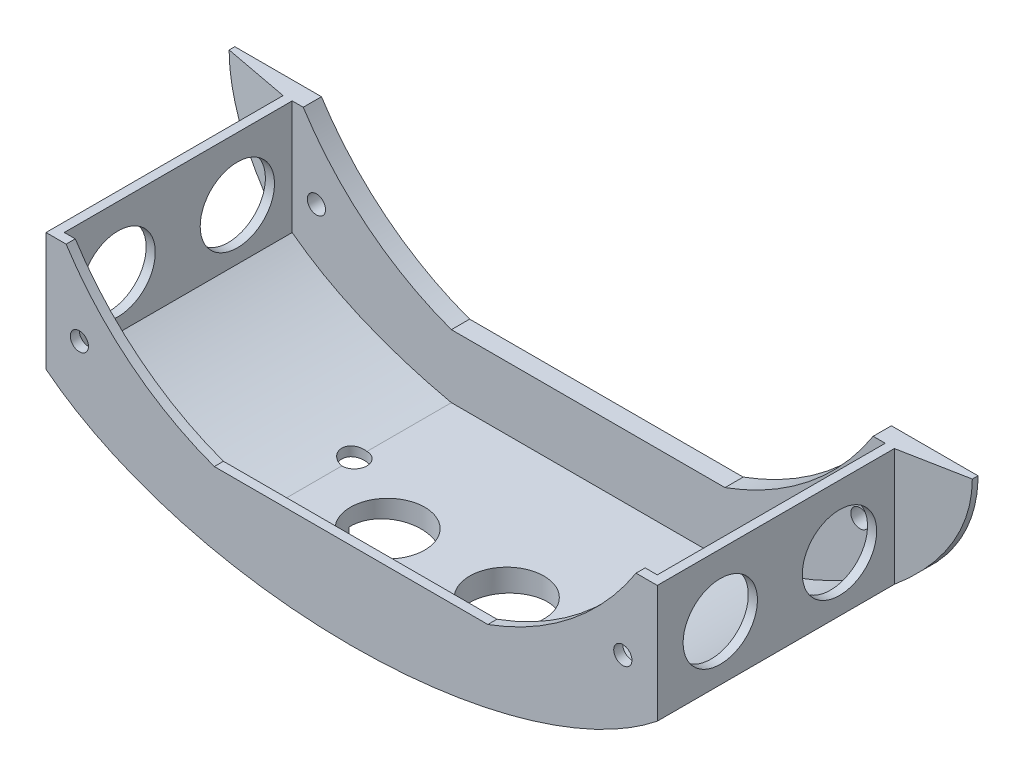
from build123d import *

# Parameters (mm, degrees)
CROQUIS1_R              = 2
SALIENTE_EXTRUIR1_DEPTH = 4
SALIENTE_EXTRUIR4_DEPTH = 50
SALIENTE_EXTRUIR5_DEPTH = 50
SALIENTE_EXTRUIR6_DEPTH = 50
CROQUIS5_R              = 8.15
CROQUIS5_R_2            = 2.75
CORTAR_EXTRUIR1_DEPTH   = 108.625508297
CROQUIS7_R              = 8.15
CORTAR_EXTRUIR2_DEPTH   = 163.92045204
CORTAR_EXTRUIR3_DEPTH   = 45
SALIENTE_EXTRUIR7_REACH = 110.42
CROQUIS9_RX             = 3.839992974
CROQUIS9_RY             = 1.30664239
CROQUIS10_R             = 2
SALIENTE_EXTRUIR8_DEPTH = 2


with BuildPart() as part:
    # Croquis1 → Saliente-Extruir1 (new body)
    with BuildSketch(Plane.XY):
        with BuildLine():
            Line((30, 14), (-30, 14))
            ThreePointArc((-30, 14), (-48.387263047, 24.328421191), (-62.5, 40))
            Line((-62.5, 40), (-81.5, 40))
            add(Edge.make_bspline(
                [(-81.5, 40), (-81.5, 36.750529527), (-80.260995736, 30.280968201), (-73.321740908, 18.442769728), (-57.739765713, 6.428777931), (-31.065541534, -2.851449154), (0, -6.074275423), (31.065541534, -2.851449154), (57.739765713, 6.428777931), (73.321740908, 18.442769728), (80.260995736, 30.280968201), (81.5, 36.750529527), (81.5, 40)],
                knots=[3.141592654, 3.141592654, 3.141592654, 3.141592654, 3.337942194, 3.534291735, 3.926990817, 4.319689899, 4.71238898, 5.105088062, 5.497787144, 5.890486225, 6.086835766, 6.283185307, 6.283185307, 6.283185307, 6.283185307], degree=3))
            Line((81.5, 40), (62.5, 40))
            ThreePointArc((62.5, 40), (48.387263047, 24.328421191), (30, 14))
        make_face()
        with Locations((-59.6, 23)):
            Circle(CROQUIS1_R, mode=Mode.SUBTRACT)
        with Locations((59.6, 23)):
            Circle(CROQUIS1_R, mode=Mode.SUBTRACT)
    extrude(amount=SALIENTE_EXTRUIR1_DEPTH)

    # Croquis3 → Saliente-Extruir4 (add)
    with BuildSketch(Plane.XY.offset(4)):
        with BuildLine():
            add(Edge.make_bspline(
                [(-64.915206918, 14.991256302), (-62.105699105, 12.849154976), (-52.210848702, 6.636843091), (-30.654961286, -0.878496362), (0, -4.060751819), (30.654961286, -0.878496362), (52.327651134, 6.677565604), (62.285664512, 12.962440117), (65.154606968, 15.174823907)],
                knots=[3.742653673, 3.742653673, 3.742653673, 3.742653673, 3.926990817, 4.319689899, 4.71238898, 5.105088062, 5.497787144, 5.687378882, 5.687378882, 5.687378882, 5.687378882], degree=3))
            Line((-64.915206918, 14.991256302), (-64.915206918, 12.500824613))
            add(Edge.make_bspline(
                [(-64.915206918, 12.500824613), (-62.321363618, 10.626620508), (-52.451686081, 4.589002592), (-31.065541534, -2.851449154), (0, -6.074275423), (31.065541534, -2.851449154), (52.56287748, 4.627687183), (62.49681742, 10.734212628), (65.154606968, 12.674706809)],
                knots=[3.767845746, 3.767845746, 3.767845746, 3.767845746, 3.926990817, 4.319689899, 4.71238898, 5.105088062, 5.497787144, 5.661843108, 5.661843108, 5.661843108, 5.661843108], degree=3))
            Line((65.154606968, 12.674706809), (65.154606968, 15.174823907))
        make_face()
    extrude(amount=SALIENTE_EXTRUIR4_DEPTH)

    # Croquis4 → Saliente-Extruir5 (add)
    with BuildSketch(Plane.XY.offset(4)):
        with BuildLine():
            add(Edge.make_bspline(
                [(-66.915206918, 14.012148949), (-66.26653664, 13.499203986), (-65.599660935, 12.995382835), (-64.915206919, 12.500824615)],
                knots=[3.725851119, 3.725851119, 3.725851119, 3.725851119, 3.767845746, 3.767845746, 3.767845746, 3.767845746], degree=3))
            Line((-64.915206919, 12.500824615), (-64.915206918, 40))
            Line((-64.915206918, 40), (-66.915206918, 40))
            Line((-66.915206918, 40), (-66.915206918, 14.012148949))
        make_face()
        with BuildLine():
            Line((65.154606972, 40), (65.154606972, 12.674706812))
            add(Edge.make_bspline(
                [(65.154606972, 12.674706812), (65.839368943, 13.174662356), (66.506248757, 13.683985312), (67.154606972, 14.202533828)],
                knots=[5.661843108, 5.661843108, 5.661843108, 5.661843108, 5.704111047, 5.704111047, 5.704111047, 5.704111047], degree=3))
            Line((67.154606972, 14.202533828), (67.154606972, 40))
            Line((67.154606972, 40), (65.154606972, 40))
        make_face()
    extrude(amount=SALIENTE_EXTRUIR5_DEPTH)

    # Croquis6 → Saliente-Extruir6 (add)
    with BuildSketch(Plane.XY.offset(4)):
        with BuildLine():
            Line((30, 0.132260611), (-30, 0.132260611))
            add(Edge.make_bspline(
                [(-30, 0.132260611), (-29.970134879, 0.125768738), (-20.468869195, -1.935902595), (0, -4.060751819), (20.468869195, -1.935902595), (29.970134879, 0.125768738), (30, 0.132260611)],
                knots=[4.318451335, 4.318451335, 4.318451335, 4.318451335, 4.319689899, 4.71238898, 5.105088062, 5.106326626, 5.106326626, 5.106326626, 5.106326626], degree=3))
        make_face()
    extrude(amount=SALIENTE_EXTRUIR6_DEPTH)

    # Croquis5 → Cortar-Extruir1 (cut, through all)
    with BuildSketch(Plane(origin=(0, 40, 0), x_dir=(-1, 0, 0), z_dir=(0, 1, 0))):
        with Locations((-13.075, 34.920904435)):
            Circle(CROQUIS5_R)
        with Locations((13.075, 34.920904435)):
            Circle(CROQUIS5_R)
        with Locations((-30, 25.280127375)):
            Circle(CROQUIS5_R_2)
        with Locations((30, 25.280127375)):
            Circle(CROQUIS5_R_2)
    extrude(amount=-CORTAR_EXTRUIR1_DEPTH, mode=Mode.SUBTRACT)

    # Croquis7 → Cortar-Extruir2 (cut, through all)
    with BuildSketch(Plane.ZY.offset(66.915206918)):
        with Locations((42.181238891, 26.250412307)):
            Circle(CROQUIS7_R)
        with Locations((16.031238891, 26.250412307)):
            Circle(CROQUIS7_R)
    extrude(amount=-CORTAR_EXTRUIR2_DEPTH, mode=Mode.SUBTRACT)

    # Croquis8 → Cortar-Extruir3 (cut)
    with BuildSketch(Plane(origin=(0, 40, 0), x_dir=(1, 0, 0), z_dir=(0, 1, 0))):
        Polygon((67.154606972, -4), (81.5, -1.244992905), (81.5, -4), align=None)
        Polygon((-66.915206918, -4), (-81.5, -1.244992905), (-81.5, -4), align=None)
    extrude(amount=-CORTAR_EXTRUIR3_DEPTH, mode=Mode.SUBTRACT)

    # Croquis9 → Saliente-Extruir7 (add, up to next)
    with BuildSketch(Plane(origin=(0, -6.867739389, 0), x_dir=(1, 0, 0), z_dir=(0, 1, 0)), mode=Mode.PRIVATE) as saliente_extruir7_sk1:
        with Locations(Location((0, -26.777110278), (0, 0, -179.748194464))):
            Ellipse(CROQUIS9_RX, CROQUIS9_RY)
    saliente_extruir7_tool1 = extrude(saliente_extruir7_sk1.sketch, amount=SALIENTE_EXTRUIR7_REACH, mode=Mode.PRIVATE) - part.part
    # Croquis9 → Saliente-Extruir7 (add, up to next)
    with BuildSketch(Plane(origin=(0, -6.867739389, 0), x_dir=(1, 0, 0), z_dir=(0, 1, 0)), mode=Mode.PRIVATE) as saliente_extruir7_sk2:
        with BuildLine():
            Line((20.905252403, -44.769055477), (15.218522217, -48.850856524))
            ThreePointArc((15.218522217, -48.850856524), (13.823017755, -48.621580932), (14.052293347, -47.22607647))
            Line((14.052293347, -47.22607647), (19.739023533, -43.144275423))
            ThreePointArc((19.739023533, -43.144275423), (21.134527995, -43.373551015), (20.905252403, -44.769055477))
        make_face()
    saliente_extruir7_tool2 = extrude(saliente_extruir7_sk2.sketch, amount=SALIENTE_EXTRUIR7_REACH, mode=Mode.PRIVATE) - part.part
    # Croquis9 → Saliente-Extruir7 (add, up to next)
    with BuildSketch(Plane(origin=(0, -6.867739389, 0), x_dir=(1, 0, 0), z_dir=(0, 1, 0)), mode=Mode.PRIVATE) as saliente_extruir7_sk3:
        with BuildLine():
            Line((-15.218522217, -48.850856524), (-20.905252403, -44.769055477))
            ThreePointArc((-20.905252403, -44.769055477), (-21.134527995, -43.373551015), (-19.739023533, -43.144275423))
            Line((-19.739023533, -43.144275423), (-14.052293347, -47.22607647))
            ThreePointArc((-14.052293347, -47.22607647), (-13.823017755, -48.621580932), (-15.218522217, -48.850856524))
        make_face()
    saliente_extruir7_tool3 = extrude(saliente_extruir7_sk3.sketch, amount=SALIENTE_EXTRUIR7_REACH, mode=Mode.PRIVATE) - part.part
    # Croquis9 → Saliente-Extruir7 (add, up to next)
    with BuildSketch(Plane(origin=(0, -6.867739389, 0), x_dir=(1, 0, 0), z_dir=(0, 1, 0)), mode=Mode.PRIVATE) as saliente_extruir7_sk4:
        with BuildLine():
            ThreePointArc((20.851449027, -37.360031438), (21.108969525, -36.29124515), (21.220304261, -35.1975242))
            add(Edge.make_bspline(
                [(25.174082575, -40.265084821), (24.497563288, -36.384895525), (23.956916187, -35.792679393), (21.220304261, -35.1975242)],
                knots=[0, 0, 0, 0, 0.707855223, 0.707855223, 0.707855223, 0.707855223], degree=3))
            add(Edge.make_bspline(
                [(20.851449027, -37.360031438), (21.718021683, -37.775874086), (22.980240826, -38.334780759), (22.870065394, -38.124936146), (25.174082575, -40.265084821)],
                knots=[0, 0, 0, 0, 0.283616743, 1, 1, 1, 1], degree=3))
        make_face()
    saliente_extruir7_tool4 = extrude(saliente_extruir7_sk4.sketch, amount=SALIENTE_EXTRUIR7_REACH, mode=Mode.PRIVATE) - part.part
    # Croquis9 → Saliente-Extruir7 (add, up to next)
    with BuildSketch(Plane(origin=(0, -6.867739389, 0), x_dir=(1, 0, 0), z_dir=(0, 1, 0)), mode=Mode.PRIVATE) as saliente_extruir7_sk5:
        with BuildLine():
            ThreePointArc((10.670050279, -23.705541928), (-0.318286045, -21.620359675), (-11.306622369, -23.705541928))
            ThreePointArc((-11.306622369, -23.705541928), (-11.955031301, -23.423467723), (-11.672957095, -22.775058791))
            ThreePointArc((-11.672957095, -22.775058791), (-0.318286045, -20.620359675), (11.036385005, -22.775058791))
            ThreePointArc((11.036385005, -22.775058791), (11.318459211, -23.423467723), (10.670050279, -23.705541928))
        make_face()
    saliente_extruir7_tool5 = extrude(saliente_extruir7_sk5.sketch, amount=SALIENTE_EXTRUIR7_REACH, mode=Mode.PRIVATE) - part.part
    # Croquis9 → Saliente-Extruir7 (add, up to next)
    with BuildSketch(Plane(origin=(0, -6.867739389, 0), x_dir=(1, 0, 0), z_dir=(0, 1, 0)), mode=Mode.PRIVATE) as saliente_extruir7_sk6:
        with BuildLine():
            ThreePointArc((-20.851449027, -37.360031438), (-21.108969525, -36.29124515), (-21.220304261, -35.1975242))
            add(Edge.make_bspline(
                [(-25.174082575, -40.265084821), (-24.497563288, -36.384895525), (-23.956916187, -35.792679393), (-21.220304261, -35.1975242)],
                knots=[0, 0, 0, 0, 0.707855223, 0.707855223, 0.707855223, 0.707855223], degree=3))
            add(Edge.make_bspline(
                [(-20.851449027, -37.360031438), (-21.718021683, -37.775874086), (-22.980240826, -38.334780759), (-22.870065394, -38.124936146), (-25.174082575, -40.265084821)],
                knots=[0, 0, 0, 0, 0.283616743, 1, 1, 1, 1], degree=3))
        make_face()
    saliente_extruir7_tool6 = extrude(saliente_extruir7_sk6.sketch, amount=SALIENTE_EXTRUIR7_REACH, mode=Mode.PRIVATE) - part.part
    add(saliente_extruir7_tool1.solids().sort_by_distance((0, -6.867739, 26.77711))[0])
    add(saliente_extruir7_tool2.solids().sort_by_distance((17.478773, -6.867739, 45.997566))[0])
    add(saliente_extruir7_tool3.solids().sort_by_distance((-17.478773, -6.867739, 45.997566))[0])
    add(saliente_extruir7_tool4.solids().sort_by_distance((22.985113, -6.867739, 37.303397))[0])
    add(saliente_extruir7_tool5.solids().sort_by_distance((11.099325, -6.867739, 23.337194))[0])
    add(saliente_extruir7_tool6.solids().sort_by_distance((-22.985113, -6.867739, 37.303397))[0])

    # Croquis10 → Saliente-Extruir8 (add)
    with BuildSketch(Plane.XY.offset(54)):
        with BuildLine():
            Line((-66.915206918, 40), (-66.915206918, 14.012148949))
            add(Edge.make_bspline(
                [(-66.915206918, 14.012148949), (-63.808301297, 11.555320505), (-53.402519392, 4.91980693), (-31.065541534, -2.851449154), (0, -6.074275423), (31.065541534, -2.851449154), (53.519899048, 4.960644476), (63.989754318, 11.671325605), (67.154606972, 14.202533828)],
                knots=[3.725851119, 3.725851119, 3.725851119, 3.725851119, 3.926990817, 4.319689899, 4.71238898, 5.105088062, 5.497787144, 5.704111047, 5.704111047, 5.704111047, 5.704111047], degree=3))
            Line((67.154606972, 14.202533828), (67.154606972, 40))
            Line((67.154606972, 40), (62.5, 40))
            ThreePointArc((62.5, 40), (48.387263047, 24.328421191), (30, 14))
            Line((30, 14), (-30, 14))
            ThreePointArc((-30, 14), (-48.387263047, 24.328421191), (-62.5, 40))
            Line((-62.5, 40), (-66.915206918, 40))
        make_face()
        with Locations((59.6, 23)):
            Circle(CROQUIS10_R, mode=Mode.SUBTRACT)
        with Locations((-59.6, 23)):
            Circle(CROQUIS10_R, mode=Mode.SUBTRACT)
    extrude(amount=SALIENTE_EXTRUIR8_DEPTH)


solid = part.part
